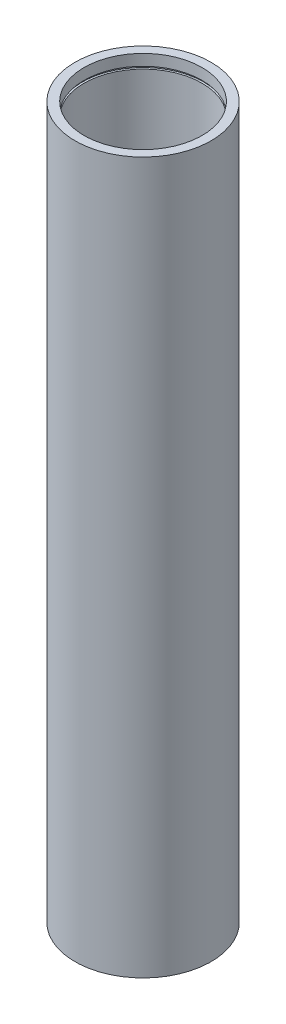
from build123d import *


with BuildPart() as part:
    # Sketch2 → Revolve1 (revolve)
    with BuildSketch(Plane.XY):
        Polygon((41.275, 487.9848), (41.275, 11.2522), (42.5958, 11.2522), (42.5958, 9.525), (41.275, 9.525), (41.275, 0), (47.625, 0), (47.625, 497.5098), (41.275, 497.5098), (41.275, 489.712), (42.5958, 489.712), (42.5958, 487.9848), align=None)
    revolve(axis=Axis((0, 0, 0), (0, 1, 0)))


solid = part.part
